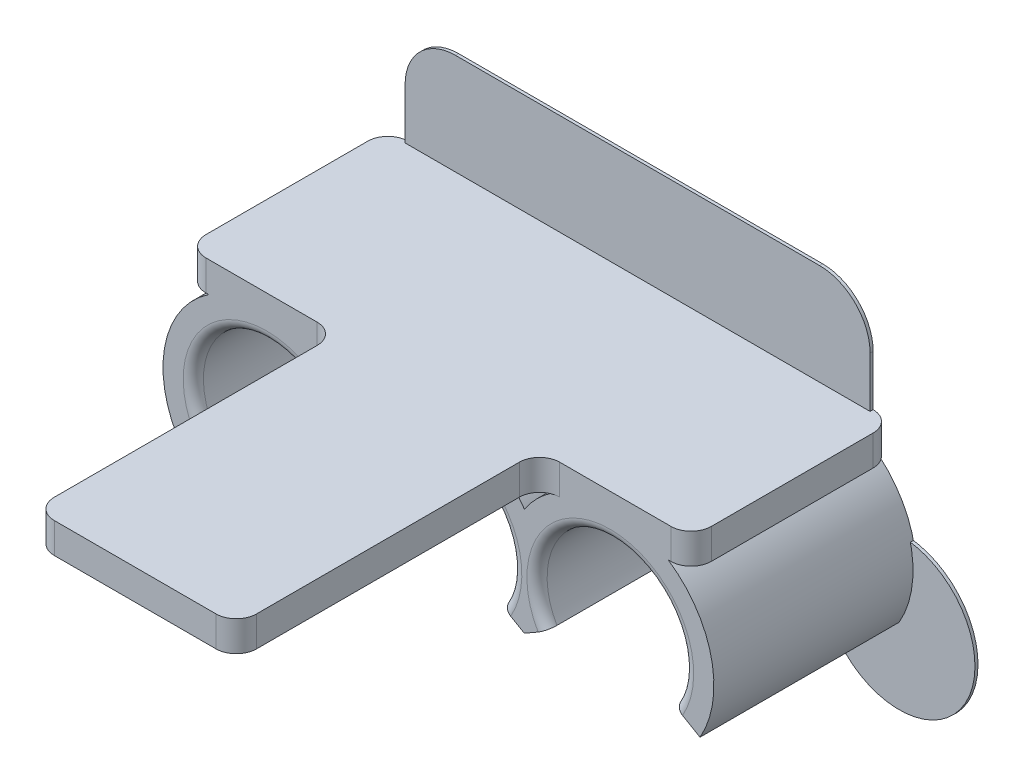
from build123d import *

# Parameters (mm, degrees)
SKETCH1_W             = 50
SKETCH1_H             = 3
WALL_MOUNT_DEPTH      = 50
BOSS_EXTRUDE3_DEPTH   = 20
CUT_EXTRUDE1_REACH    = 60.551
SKETCH4_W             = 15
SKETCH4_H             = 30
FILLET2_R             = 2
FILLET3_R             = 1
BOSS_EXTRUDE4_DEPTH   = 0.3
BOSS_EXTRUDE4_2_DEPTH = 0.3
BOSS_EXTRUDE4_3_DEPTH = 0.3
BOSS_EXTRUDE4_4_DEPTH = 0.3
BOSS_EXTRUDE4_5_DEPTH = 0.3


with BuildPart() as part:
    # Sketch1 → Wall mount (new body)
    with BuildSketch(Plane.XY):
        Rectangle(SKETCH1_W, SKETCH1_H)
    extrude(amount=WALL_MOUNT_DEPTH)

    # Sketch3 → Boss-Extrude3 (add)
    with BuildSketch(Plane.XY):
        with BuildLine():
            Line((-8.5, -14.907477288), (-6.278684177, -13.625))
            ThreePointArc((-6.278684177, -13.625), (0, -2.75), (6.278684177, -13.625))
            Line((6.278684177, -13.625), (8.5, -14.907477288))
            Line((8.5, -14.907477288), (10.721315823, -13.625))
            ThreePointArc((10.721315823, -13.625), (17, -2.75), (23.278684177, -13.625))
            Line((23.278684177, -13.625), (25.876760389, -15.125))
            ThreePointArc((25.876760389, -15.125), (26.986817136, -7.692190758), (22.728219619, -1.5))
            Line((22.728219619, -1.5), (11.271780381, -1.5))
            ThreePointArc((11.271780381, -1.5), (9.752155493, -2.752155493), (8.5, -4.271780381))
            ThreePointArc((8.5, -4.271780381), (7.247844507, -2.752155493), (5.728219619, -1.5))
            Line((5.728219619, -1.5), (-5.728219619, -1.5))
            ThreePointArc((-5.728219619, -1.5), (-7.247844507, -2.752155493), (-8.5, -4.271780381))
            ThreePointArc((-8.5, -4.271780381), (-9.752155493, -2.752155493), (-11.271780381, -1.5))
            Line((-11.271780381, -1.5), (-22.728219619, -1.5))
            ThreePointArc((-22.728219619, -1.5), (-26.986817136, -7.692190758), (-25.876760389, -15.125))
            Line((-25.876760389, -15.125), (-23.278684177, -13.625))
            ThreePointArc((-23.278684177, -13.625), (-17, -2.75), (-10.721315823, -13.625))
            Line((-10.721315823, -13.625), (-8.5, -14.907477288))
        make_face()
    extrude(amount=BOSS_EXTRUDE3_DEPTH)

    # Sketch4 → Cut-Extrude1 (cut, up to next)
    with BuildSketch(Plane.XZ.offset(1.5), mode=Mode.PRIVATE) as cut_extrude1_sk1:
        with Locations((-17.5, 35)):
            Rectangle(SKETCH4_W, SKETCH4_H)
    cut_extrude1_tool1 = extrude(cut_extrude1_sk1.sketch, amount=-CUT_EXTRUDE1_REACH, mode=Mode.PRIVATE) & part.part
    # Sketch4 → Cut-Extrude1 (cut, up to next)
    with BuildSketch(Plane.XZ.offset(1.5), mode=Mode.PRIVATE) as cut_extrude1_sk2:
        with Locations((17.5, 35)):
            Rectangle(SKETCH4_W, SKETCH4_H)
    cut_extrude1_tool2 = extrude(cut_extrude1_sk2.sketch, amount=-CUT_EXTRUDE1_REACH, mode=Mode.PRIVATE) & part.part
    add(cut_extrude1_tool1.solids().sort_by_distance((-17.5, -1.5, 35))[0], mode=Mode.SUBTRACT)
    add(cut_extrude1_tool2.solids().sort_by_distance((17.5, -1.5, 35))[0], mode=Mode.SUBTRACT)

    # Fillet2
    # the kernel refuses this fillet: 2 mm, written as the material it adds along each edge
    with BuildSketch(Plane(origin=(-10, -1.5, 20), x_dir=(-1, 0, 0), z_dir=(0, 1, 0))) as fillet2_piece_1:
        with BuildLine():
            CenterArc((FILLET2_R, FILLET2_R), FILLET2_R, 180, 90)
            Line((0, FILLET2_R), (0, 0))
            Line((0, 0), (FILLET2_R, 0))
        make_face()
    extrude(amount=3)
    with BuildSketch(Plane(origin=(10, -1.5, 20), x_dir=(1, 0, 0), z_dir=(0, 1, 0))) as fillet2_piece_2:
        with BuildLine():
            CenterArc((FILLET2_R, -FILLET2_R), FILLET2_R, 90, 90)
            Line((0, -FILLET2_R), (0, 0))
            Line((0, 0), (FILLET2_R, 0))
        make_face()
    extrude(amount=3)
    # the kernel refuses this fillet: 2 mm, written as the material it takes off along each edge
    with BuildSketch(Plane(origin=(25, 6.5, 0), x_dir=(-1, 0, 0), z_dir=(0, -1, 0)), Plane(origin=(-25, -1.5, 0), x_dir=(1, 0, 0), z_dir=(0, 1, 0)), Plane(origin=(25, -1.5, 20), x_dir=(-1, 0, 0), z_dir=(0, 1, 0))) as fillet2_2_piece_1:
        with BuildLine():
            CenterArc((FILLET2_R, -FILLET2_R), FILLET2_R, 90, 90)
            Line((0, -FILLET2_R), (0, 0))
            Line((0, 0), (FILLET2_R, 0))
        make_face()
    extrude(amount=8, mode=Mode.SUBTRACT)
    with BuildSketch(Plane(origin=(-10, -6.5, 50), x_dir=(1, 0, 0), z_dir=(0, 1, 0)), Plane(origin=(10, -6.5, 50), x_dir=(0, 0, -1), z_dir=(0, 1, 0))) as fillet2_2_piece_2:
        with BuildLine():
            CenterArc((FILLET2_R, FILLET2_R), FILLET2_R, 180, 90)
            Line((0, FILLET2_R), (0, 0))
            Line((0, 0), (FILLET2_R, 0))
        make_face()
    extrude(amount=13, mode=Mode.SUBTRACT)
    with BuildSketch(Plane(origin=(-25, -1.5, 20), x_dir=(1, 0, 0), z_dir=(0, 1, 0))) as fillet2_2_piece_3:
        with BuildLine():
            CenterArc((FILLET2_R, FILLET2_R), FILLET2_R, 180, 90)
            Line((0, FILLET2_R), (0, 0))
            Line((0, 0), (FILLET2_R, 0))
        make_face()
    extrude(amount=8, mode=Mode.SUBTRACT)

    # Fillet3
    fillet3_edges = [part.edges().sort_by_distance(p)[0] for p in [
        (0, -2.75, 20),
        (17, -2.75, 20),
        (-17, -2.75, 20),
    ]]
    fillet(fillet3_edges, radius=FILLET3_R)


with BuildPart() as body_2:
    # Sketch5 → Boss-Extrude4 (new body)
    with BuildSketch(Plane.XY):
        with BuildLine():
            Line((-23.278684177, -13.625), (-18.52829116, -13.625))
            ThreePointArc((-18.52829116, -13.625), (-31.338649406, -20.264821822), (-23.933462834, -7.881134001))
            ThreePointArc((-23.933462834, -7.881134001), (-24.203346883, -10.821153871), (-23.278684177, -13.625))
        make_face()
    extrude(amount=BOSS_EXTRUDE4_DEPTH)


with BuildPart() as body_3:
    # Sketch5 → Boss-Extrude4 2 (new body)
    with BuildSketch(Plane.XY):
        with BuildLine():
            Line((-23, 1.5), (23, 1.5))
            Line((23, 1.5), (23, 6.5))
            ThreePointArc((23, 6.5), (21.535533906, 10.035533906), (18, 11.5))
            Line((18, 11.5), (-18, 11.5))
            ThreePointArc((-18, 11.5), (-21.535533906, 10.035533906), (-23, 6.5))
            Line((-23, 6.5), (-23, 1.5))
        make_face()
    extrude(amount=BOSS_EXTRUDE4_2_DEPTH)


with BuildPart() as body_4:
    # Sketch5 → Boss-Extrude4 3 (new body)
    with BuildSketch(Plane.XY):
        with BuildLine():
            Line((-15.889536657, -13.625), (-1.110463343, -13.625))
            ThreePointArc((-1.110463343, -13.625), (-8.5, -22.407477288), (-15.889536657, -13.625))
        make_face()
    extrude(amount=BOSS_EXTRUDE4_3_DEPTH)


with BuildPart() as body_5:
    # Sketch5 → Boss-Extrude4 4 (new body)
    with BuildSketch(Plane.XY):
        with BuildLine():
            Line((1.110463343, -13.625), (15.889536657, -13.625))
            ThreePointArc((15.889536657, -13.625), (8.5, -22.407477288), (1.110463343, -13.625))
        make_face()
    extrude(amount=BOSS_EXTRUDE4_4_DEPTH)


with BuildPart() as body_6:
    # Sketch5 → Boss-Extrude4 5 (new body)
    with BuildSketch(Plane.XY):
        with BuildLine():
            Line((18.52829116, -13.625), (23.278684177, -13.625))
            ThreePointArc((23.278684177, -13.625), (24.203346883, -10.821153871), (23.933462834, -7.881134001))
            ThreePointArc((23.933462834, -7.881134001), (31.338649406, -20.264821822), (18.52829116, -13.625))
        make_face()
    extrude(amount=BOSS_EXTRUDE4_5_DEPTH)


solid = Compound([part.part, body_2.part, body_3.part, body_4.part, body_5.part, body_6.part])
